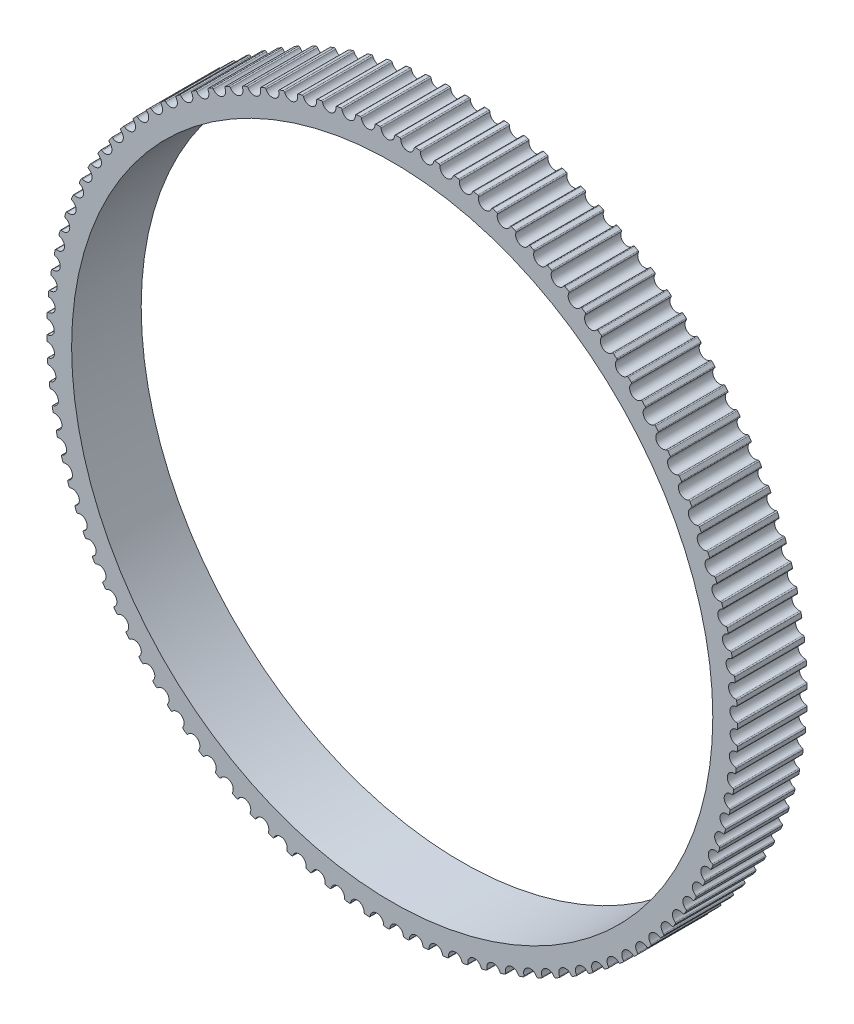
from build123d import *

# Parameters (mm, degrees)
BOSS_EXTRUDE1_DEPTH = 3.5
SKETCH4_R           = 32.25
CUT_EXTRUDE2_DEPTH  = 3.5


with BuildPart() as part:
    # Sketch2 → Boss-Extrude1 (new, symmetric)
    with BuildSketch(Plane.XY):
        with BuildLine():
            ThreePointArc((-3.211333328, 34.601298216), (-3.132582306, 34.577768977), (-3.092122191, 34.506226488))
            ThreePointArc((-3.092122191, 34.506226488), (-2.370608918, 33.917255392), (-1.738041502, 34.600868455))
            ThreePointArc((-1.738041502, 34.600868455), (-1.707926922, 34.677343683), (-1.633214692, 34.711599067))
            ThreePointArc((-1.633214692, 34.711599067), (-1.432005901, 34.720481839), (-1.230749008, 34.728198296))
            ThreePointArc((-1.230749008, 34.728198296), (-1.153469677, 34.700211628), (-1.117159824, 34.626475997))
            ThreePointArc((-1.117159824, 34.626475997), (-0.430446923, 33.997275118), (0.240115498, 34.643660757))
            ThreePointArc((0.240115498, 34.643660757), (0.274546844, 34.718292057), (0.351092826, 34.748226341))
            ThreePointArc((0.351092826, 34.748226341), (0.552480572, 34.745607855), (0.75384976, 34.741822211))
            ThreePointArc((0.75384976, 34.741822211), (0.829405331, 34.709469401), (0.861446487, 34.63378114))
            ThreePointArc((0.861446487, 34.63378114), (1.5111191, 33.966402798), (2.217489291, 34.573452638))
            ThreePointArc((2.217489291, 34.573452638), (2.256125096, 34.645996578), (2.334255151, 34.671512123))
            ThreePointArc((2.334255151, 34.671512123), (2.535164969, 34.657400921), (2.735989626, 34.642125523))
            ThreePointArc((2.735989626, 34.642125523), (2.809574991, 34.6055121), (2.837242938, 34.528118086))
            ThreePointArc((2.837242938, 34.528118086), (3.447756167, 33.824739133), (4.187630095, 34.390473103))
            ThreePointArc((4.187630095, 34.390473103), (4.230344336, 34.460693059), (4.309803622, 34.481706639))
            ThreePointArc((4.309803622, 34.481706639), (4.509580184, 34.456148748), (4.709205264, 34.429433422))
            ThreePointArc((4.709205264, 34.429433422), (4.780580401, 34.388678811), (4.803784892, 34.309831489))
            ThreePointArc((4.803784892, 34.309831489), (5.373147369, 33.572746199), (6.14411172, 34.095318993))
            ThreePointArc((6.14411172, 34.095318993), (6.190765072, 34.162985922), (6.271294408, 34.179428995))
            ThreePointArc((6.271294408, 34.179428995), (6.469286087, 34.14250778), (6.667060452, 34.104439666))
            ThreePointArc((6.667060452, 34.104439666), (6.735992552, 34.059676799), (6.754657899, 33.979633352))
            ThreePointArc((6.754657899, 33.979633352), (7.281012482, 33.211245945), (8.080552529, 33.68895304))
            ThreePointArc((8.080552529, 33.68895304), (8.13099282, 33.753846226), (8.212329536, 33.765665158))
            ThreePointArc((8.212329536, 33.765665158), (8.407890523, 33.717501049), (8.603169075, 33.668204316))
            ThreePointArc((8.603169075, 33.668204316), (8.669433295, 33.619579201), (8.683498616, 33.538600714))
            ThreePointArc((8.683498616, 33.538600714), (9.165128446, 32.74141751), (9.990636256, 33.172700723))
            ThreePointArc((9.990636256, 33.172700723), (10.044698959, 33.2346085), (10.126577752, 33.24176474))
            ThreePointArc((10.126577752, 33.24176474), (10.319070167, 33.182514837), (10.511215949, 33.122150282))
            ThreePointArc((10.511215949, 33.122150282), (10.574596148, 33.069821524), (10.584015565, 32.988172132))
            ThreePointArc((10.584015565, 32.988172132), (11.019349666, 32.164793376), (11.868132604, 32.548245952))
            ThreePointArc((11.868132604, 32.548245952), (11.925641377, 32.606966388), (12.007795176, 32.609436594))
            ThreePointArc((12.007795176, 32.609436594), (12.196591149, 32.539294158), (12.384977421, 32.468058678))
            ThreePointArc((12.384977421, 32.468058678), (12.445266867, 32.412196962), (12.450009655, 32.330142989))
            ThreePointArc((12.450009655, 32.330142989), (12.837628057, 31.483254372), (13.70691757, 31.817625568))
            ThreePointArc((13.70691757, 31.817625568), (13.767684832, 31.87296713), (13.849845668, 31.870743245))
            ThreePointArc((13.849845668, 31.870743245), (14.034329387, 31.789937066), (14.21834167, 31.708063015))
            ThreePointArc((14.21834167, 31.708063015), (14.275343712, 31.648850551), (14.275394401, 31.566659639))
            ThreePointArc((14.275394401, 31.566659639), (14.614032774, 30.699023536), (15.50099342, 30.983222703))
            ThreePointArc((15.50099342, 30.983222703), (15.564820961, 31.035004878), (15.646720842, 31.028094155))
            ThreePointArc((15.646720842, 31.028094155), (15.826290558, 30.936887807), (16.005328645, 30.844642241))
            ThreePointArc((16.005328645, 30.844642241), (16.058857353, 30.782272168), (16.054215778, 30.700212407))
            ThreePointArc((16.054215778, 30.700212407), (16.342769554, 29.814658866), (17.244508252, 30.047759005))
            ThreePointArc((17.244508252, 30.047759005), (17.31118788, 30.09581289), (17.392559666, 30.084237871))
            ThreePointArc((17.392559666, 30.084237871), (17.56662966, 29.982928849), (17.740109564, 29.880612655))
            ThreePointArc((17.740109564, 29.880612655), (17.78999034, 29.815288411), (17.78067164, 29.733627463))
            ThreePointArc((17.78067164, 29.733627463), (18.018199616, 28.833044976), (18.931775082, 29.014285763))
            ThreePointArc((18.931775082, 29.014285763), (19.001089301, 29.058454616), (19.081667574, 29.042253056))
            ThreePointArc((19.081667574, 29.042253056), (19.249670067, 28.93117181), (19.417025934, 28.819118722))
            ThreePointArc((19.417025934, 28.819118722), (19.463096075, 28.75105338), (19.449130647, 28.670057606))
            ThreePointArc((19.449130647, 28.670057606), (19.634858056, 27.757383686), (20.557290396, 27.886173951))
            ThreePointArc((20.557290396, 27.886173951), (20.629013119, 27.926313703), (20.708535049, 27.905538449))
            ThreePointArc((20.708535049, 27.905538449), (20.869922051, 27.785047302), (21.030608, 27.663622813))
            ThreePointArc((21.030608, 27.663622813), (21.072717237, 27.59303839), (21.054150632, 27.512971981))
            ThreePointArc((21.054150632, 27.512971981), (21.187471671, 26.59118358), (22.115752103, 26.667103236))
            ThreePointArc((22.115752103, 26.667103236), (22.189649383, 26.70308296), (22.267855587, 26.677801775))
            ThreePointArc((22.267855587, 26.677801775), (22.422100687, 26.548293745), (22.575592595, 26.417893917))
            ThreePointArc((22.575592595, 26.417893917), (22.613603575, 26.345020643), (22.590496355, 26.26614476))
            ThreePointArc((22.590496355, 26.26614476), (22.670976156, 25.338248561), (23.602076822, 25.361049973))
            ThreePointArc((23.602076822, 25.361049973), (23.677907624, 25.39275231), (23.754543009, 25.363047657))
            ThreePointArc((23.754543009, 25.363047657), (23.901143092, 25.224945172), (24.046940299, 25.085995341))
            ThreePointArc((24.046940299, 25.085995341), (24.080729038, 25.011070915), (24.053156573, 24.933642834))
            ThreePointArc((24.053156573, 24.933642834), (24.08053263, 24.002665441), (25.011416473, 23.972274237))
            ThreePointArc((25.011416473, 23.972274237), (25.088933451, 23.99959578), (25.163748048, 23.965564549))
            ThreePointArc((25.163748048, 23.965564549), (25.302224935, 23.81931807), (25.439851882, 23.672271464))
            ThreePointArc((25.439851882, 23.672271464), (25.469308169, 23.595540272), (25.437360394, 23.519812547))
            ThreePointArc((25.437360394, 23.519812547), (25.411543411, 22.588790615), (26.339174082, 22.505305925))
            ThreePointArc((26.339174082, 22.505305925), (26.418124392, 22.528157557), (26.490874172, 22.489910751))
            ThreePointArc((26.490874172, 22.489910751), (26.62077618, 22.335997304), (26.749783955, 22.181333557))
            ThreePointArc((26.749783955, 22.181333557), (26.77481171, 22.103045881), (26.738592833, 22.029265521))
            ThreePointArc((26.738592833, 22.029265521), (26.65966702, 21.10123585), (27.58101878, 20.964929982))
            ThreePointArc((27.58101878, 20.964929982), (27.661144903, 20.983237166), (27.731592571, 20.940899539))
            ThreePointArc((27.731592571, 20.940899539), (27.852495986, 20.779821157), (27.972463794, 20.61804475))
            ThreePointArc((27.972463794, 20.61804475), (27.99298138, 20.538455949), (27.95260954, 20.466863609))
            ThreePointArc((27.95260954, 20.466863609), (27.820832336, 19.544853239), (28.732899927, 19.356170796))
            ThreePointArc((28.732899927, 19.356170796), (28.813940508, 19.369873818), (28.881856278, 19.323583465))
            ThreePointArc((28.881856278, 19.323583465), (28.99336674, 19.155865553), (29.103903269, 18.987504167))
            ThreePointArc((29.103903269, 18.987504167), (29.119843764, 18.906873842), (29.075450644, 18.837703042))
            ThreePointArc((29.075450644, 18.837703042), (28.89125188, 17.924719379), (29.791060327, 17.684275803))
            ThreePointArc((29.791060327, 17.684275803), (29.872751028, 17.693329967), (29.937913374, 17.643237878))
            ThreePointArc((29.937913374, 17.643237878), (30.039667157, 17.469427497), (30.140411862, 17.295030292))
            ThreePointArc((30.140411862, 17.295030292), (30.15172327, 17.213621443), (30.103453672, 17.147097804))
            ThreePointArc((30.103453672, 17.147097804), (29.867434165, 16.24611881), (30.75204848, 15.954698379))
            ThreePointArc((30.75204848, 15.954698379), (30.834122844, 15.959074151), (30.896319219, 15.905343716))
            ThreePointArc((30.896319219, 15.905343716), (30.987984424, 15.7260078), (31.078608696, 15.546143623))
            ThreePointArc((31.078608696, 15.546143623), (31.085254121, 15.464221788), (31.033265491, 15.400562296))
            ThreePointArc((31.033265491, 15.400562296), (30.746195088, 14.514526779), (31.612729843, 14.173080045))
            ThreePointArc((31.612729843, 14.173080045), (31.69492016, 14.172763152), (31.753947692, 14.115569629))
            ThreePointArc((31.753947692, 14.115569629), (31.835225327, 13.931293134), (31.915433568, 13.746548664))
            ThreePointArc((31.915433568, 13.746548664), (31.917391335, 13.664381057), (31.861853248, 13.603793356))
            ThreePointArc((31.861853248, 13.603793356), (31.524668313, 12.735591378), (32.370297052, 12.345232069))
            ThreePointArc((32.370297052, 12.345232069), (32.452335234, 12.340223546), (32.508001388, 12.279753488))
            ThreePointArc((32.508001388, 12.279753488), (32.578626342, 12.091137485), (32.648156929, 11.902115321))
            ThreePointArc((32.648156929, 11.902115321), (32.645420653, 11.819969954), (32.586514263, 11.762651669))
            ThreePointArc((32.586514263, 11.762651669), (32.200314623, 10.915115125), (33.02227908, 10.477116513))
            ThreePointArc((33.02227908, 10.477116513), (33.103897536, 10.467432696), (33.156020741, 10.403883344))
            ThreePointArc((33.156020741, 10.403883344), (33.215762649, 10.211543059), (33.274388789, 10.018859752))
            ThreePointArc((33.274388789, 10.018859752), (33.266967394, 9.937004566), (33.204884841, 9.883142657))
            ThreePointArc((33.204884841, 9.883142657), (32.770930199, 9.059036036), (33.566549298, 8.57482678))
            ThreePointArc((33.566549298, 8.57482678), (33.647481805, 8.560499256), (33.695892045, 8.494077894))
            ThreePointArc((33.695892045, 8.494077894), (33.744556042, 8.298640702), (33.792086508, 8.102924745))
            ThreePointArc((33.792086508, 8.102924745), (33.780004201, 8.021626735), (33.714947986, 7.971396888))
            ThreePointArc((33.714947986, 7.971396888), (33.234653812, 7.173408254), (34.001332409, 6.644567744))
            ThreePointArc((34.001332409, 6.644567744), (34.081314982, 6.625643246), (34.125854354, 6.556566528))
            ThreePointArc((34.125854354, 6.556566528), (34.163281708, 6.358669904), (34.199561465, 6.160559682))
            ThreePointArc((34.199561465, 6.160559682), (34.182857657, 6.080084025), (34.115039979, 6.033650079))
            ThreePointArc((34.115039979, 6.033650079), (33.589972893, 5.264382305), (34.32521024, 4.69263551))
            ThreePointArc((34.32521024, 4.69263551), (34.403981993, 4.669175766), (34.444505218, 4.597669005))
            ThreePointArc((34.444505218, 4.597669005), (34.470573849, 4.397958446), (34.495484561, 4.198100153))
            ThreePointArc((34.495484561, 4.198100153), (34.474213735, 4.118709344), (34.403855803, 4.076222758))
            ThreePointArc((34.403855803, 4.076222758), (33.835728464, 3.338185035), (34.537126371, 2.725396874))
            ThreePointArc((34.537126371, 2.725396874), (34.614430366, 2.697478404), (34.650805266, 2.623774841))
            ThreePointArc((34.650805266, 2.623774841), (34.665430144, 2.422901762), (34.678890556, 2.221947294))
            ThreePointArc((34.678890556, 2.221947294), (34.653122094, 2.143900289), (34.5804534, 2.105499646))
            ThreePointArc((34.5804534, 2.105499646), (33.971118921, 1.401099299), (34.636389574, 0.74926856))
            ThreePointArc((34.636389574, 0.74926856), (34.711973662, 0.716982429), (34.744081589, 0.641322469))
            ThreePointArc((34.744081589, 0.641322469), (34.74721501, 0.439942076), (34.749181219, 0.238546905))
            ThreePointArc((34.749181219, 0.238546905), (34.718999171, 0.162098278), (34.644256745, 0.127908831))
            ThreePointArc((34.644256745, 0.127908831), (33.99570265, -0.540556531), (34.622676073, -1.229303713))
            ThreePointArc((34.622676073, -1.229303713), (34.696293715, -1.265852194), (34.72402994, -1.343221764))
            ThreePointArc((34.72402994, -1.343221764), (34.715661684, -1.544452609), (34.706127275, -1.745631574))
            ThreePointArc((34.706127275, -1.745631574), (34.67163009, -1.820232465), (34.595057726, -1.850099196))
            ThreePointArc((34.595057726, -1.850099196), (33.909399462, -2.480449178), (34.496030599, -3.203866252))
            ThreePointArc((34.496030599, -3.203866252), (34.567441669, -3.24455787), (34.590715723, -3.323384687))
            ThreePointArc((34.590715723, -3.323384687), (34.570873084, -3.523809611), (34.549869157, -3.724116166))
            ThreePointArc((34.549869157, -3.724116166), (34.511169358, -3.796625987), (34.433016819, -3.822072584))
            ThreePointArc((34.433016819, -3.822072584), (33.712490862, -4.412251116), (34.256866244, -5.167978446))
            ThreePointArc((34.256866244, -5.167978446), (34.325837814, -5.212680473), (34.344573781, -5.292707419))
            ThreePointArc((34.344573781, -5.292707419), (34.313321483, -5.491672679), (34.280916548, -5.690453466))
            ThreePointArc((34.280916548, -5.690453466), (34.238140364, -5.760635705), (34.158662568, -5.781579165))
            ThreePointArc((34.158662568, -5.781579165), (33.405619123, -6.329661207), (33.905963111, -7.115233768))
            ThreePointArc((33.905963111, -7.115233768), (33.97227021, -7.163800395), (33.986406977, -7.24476644))
            ThreePointArc((33.986406977, -7.24476644), (33.943846959, -7.441623052), (33.900146714, -7.638229688))
            ThreePointArc((33.900146714, -7.638229688), (33.853433673, -7.705855426), (33.77288986, -7.722227437))
            ThreePointArc((33.77288986, -7.722227437), (32.989785199, -8.226425259), (33.444465774, -9.039280676))
            ThreePointArc((33.444465774, -9.039280676), (33.507892122, -9.09155349), (33.517383579, -9.173194539))
            ThreePointArc((33.517383579, -9.173194539), (33.463654661, -9.367300397), (33.408801648, -9.561091593))
            ThreePointArc((33.408801648, -9.561091593), (33.358304118, -9.625940249), (33.276957005, -9.637687408))
            ThreePointArc((33.276957005, -9.637687408), (32.466345452, -10.096356422), (32.873879542, -10.93384333))
            ThreePointArc((32.873879542, -10.93384333), (32.934218255, -10.989651827), (32.939033441, -11.071701583))
            ThreePointArc((32.939033441, -11.071701583), (32.874310877, -11.262423555), (32.808484015, -11.452767205))
            ThreePointArc((32.808484015, -11.452767205), (32.754366709, -11.514627255), (32.672481633, -11.521711246))
            ThreePointArc((32.672481633, -11.521711246), (31.837007234, -11.933355369), (32.196065547, -12.792742059))
            ThreePointArc((32.196065547, -12.792742059), (32.253119813, -12.851904204), (32.253243023, -12.934095039))
            ThreePointArc((32.253243023, -12.934095039), (32.177737925, -13.120811029), (32.101151926, -13.307086271))
            ThreePointArc((32.101151926, -13.307086271), (32.043591363, -13.365755941), (31.961435416, -13.368153657))
            ThreePointArc((31.961435416, -13.368153657), (31.103823316, -13.731430191), (31.413234678, -14.609913523))
            ThreePointArc((31.413234678, -14.609913523), (31.466818398, -14.67223634), (31.462249231, -14.754300165))
            ThreePointArc((31.462249231, -14.754300165), (31.376207879, -14.936401144), (31.289112552, -15.118000387))
            ThreePointArc((31.289112552, -15.118000387), (31.228296483, -15.173288309), (31.146137641, -15.170991929))
            ThreePointArc((31.146137641, -15.170991929), (30.269185192, -15.484715942), (30.527940367, -16.379430485))
            ThreePointArc((30.527940367, -16.379430485), (30.577878762, -16.444710691), (30.56863212, -16.52637983))
            ThreePointArc((30.56863212, -16.52637983), (30.472335165, -16.703271823), (30.375014597, -16.879602728))
            ThreePointArc((30.375014597, -16.879602728), (30.31114139, -16.931328564), (30.229247639, -16.924345579))
            ThreePointArc((30.229247639, -16.924345579), (29.335815277, -17.187493768), (29.54307026, -18.09552115))
            ThreePointArc((29.54307026, -18.09552115), (29.589200441, -18.163545815), (29.575306486, -18.24455388))
            ThreePointArc((29.575306486, -18.24455388), (29.469068027, -18.415659902), (29.361839657, -18.586147313))
            ThreePointArc((29.361839657, -18.586147313), (29.295117655, -18.634142344), (29.213756114, -18.622495531))
            ThreePointArc((29.213756114, -18.622495531), (28.30675803, -18.834209562), (28.461836798, -19.752587986))
            ThreePointArc((28.461836798, -19.752587986), (28.504008299, -19.823135227), (28.485512349, -19.903217987))
            ThreePointArc((28.485512349, -19.903217987), (28.369678915, -20.067979925), (28.252892499, -20.232067749))
            ThreePointArc((28.252892499, -20.232067749), (28.183539334, -20.276175426), (28.102975388, -20.259902774))
            ThreePointArc((28.102975388, -20.259902774), (27.185370022, -20.419492079), (27.287766741, -21.345225986))
            ThreePointArc((27.287766741, -21.345225986), (27.325842006, -21.418065692), (27.302804391, -21.496961933))
            ThreePointArc((27.302804391, -21.496961933), (27.177753806, -21.654842369), (27.051790279, -21.811995386))
            ThreePointArc((27.051790279, -21.811995386), (26.980032167, -21.852071837), (26.900528599, -21.831226424))
            ThreePointArc((26.900528599, -21.831226424), (25.975308988, -21.938170457), (26.02468966, -22.868240295))
            ThreePointArc((26.02468966, -22.868240295), (26.058544496, -22.943134878), (26.031040361, -23.020587258))
            ThreePointArc((26.031040361, -23.020587258), (25.897180514, -23.171071219), (25.762450741, -23.320776827))
            ThreePointArc((25.762450741, -23.320776827), (25.688521742, -23.356691333), (25.610337876, -23.331341152))
            ThreePointArc((25.610337876, -23.331341152), (24.680521894, -23.385291083), (24.676725451, -24.316663157))
            ThreePointArc((24.676725451, -24.316663157), (24.706249431, -24.393368328), (24.674368488, -24.469124213))
            ThreePointArc((24.674368488, -24.469124213), (24.532136002, -24.61172085), (24.389079444, -24.753490741))
            ThreePointArc((24.389079444, -24.753490741), (24.313220699, -24.785126155), (24.236611554, -24.755353895))
            ThreePointArc((24.236611554, -24.755353895), (23.305232069, -24.75613375), (23.248270892, -25.685770119))
            ThreePointArc((23.248270892, -25.685770119), (23.273367715, -25.76403568), (23.237213953, -25.83784797))
            ThreePointArc((23.237213953, -25.83784797), (23.087072761, -25.972092163), (22.936156039, -26.105463914))
            ThreePointArc((22.936156039, -26.105463914), (22.858614984, -26.132717049), (22.783830443, -26.098619818))
            ThreePointArc((22.783830443, -26.098619818), (21.85392542, -26.046227054), (21.743985306, -26.971095437))
            ThreePointArc((21.743985306, -26.971095437), (21.764573111, -27.050666103), (21.724264456, -27.122294037))
            ThreePointArc((21.724264456, -27.122294037), (21.566704287, -27.24774791), (21.40841966, -27.372286489))
            ThreePointArc((21.40841966, -27.372286489), (21.329449217, -27.39506845), (21.256733213, -27.356757468))
            ThreePointArc((21.256733213, -27.356757468), (20.331335809, -27.251362979), (20.16877536, -28.168446648))
            ThreePointArc((20.16877536, -28.168446648), (20.184786993, -28.249062876), (20.140454924, -28.318272819))
            ThreePointArc((20.140454924, -28.318272819), (19.975989707, -28.434527167), (19.810853466, -28.549826356))
            ThreePointArc((19.810853466, -28.549826356), (19.730711221, -28.568062833), (19.660300937, -28.525663062))
            ThreePointArc((19.660300937, -28.525663062), (18.742429606, -28.367610623), (18.527779061, -29.273918241))
            ThreePointArc((18.527779061, -29.273918241), (18.539162295, -29.355317077), (18.490951414, -29.421883281))
            ThreePointArc((18.490951414, -29.421883281), (18.320117601, -29.528558907), (18.148668386, -29.634242622))
            ThreePointArc((18.148668386, -29.634242622), (18.067615746, -29.647874132), (17.999740847, -29.601523872))
            ThreePointArc((17.999740847, -29.601523872), (17.092389494, -29.391329017), (16.826348997, -30.283904397))
            ThreePointArc((16.826348997, -30.283904397), (16.833066704, -30.365820336), (16.781134264, -30.429525675))
            ThreePointArc((16.781134264, -30.429525675), (16.604489078, -30.526274624), (16.427286122, -30.621998149))
            ThreePointArc((16.427286122, -30.621998149), (16.345587463, -30.630980229), (16.280469342, -30.580830663))
            ThreePointArc((16.280469342, -30.580830663), (15.38659756, -30.319179005), (15.07003488, -31.195110751))
            ThreePointArc((15.07003488, -31.195110751), (15.072065148, -31.2772766), (15.016580542, -31.337913281))
            ThreePointArc((15.016580542, -31.337913281), (14.834700164, -31.42441998), (14.652321465, -31.509871083))
            ThreePointArc((14.652321465, -31.509871083), (14.570243272, -31.514174435), (14.508094331, -31.460389142))
            ThreePointArc((14.508094331, -31.460389142), (13.630617742, -31.148134133), (13.264565442, -32.004565139))
            ThreePointArc((13.264565442, -32.004565139), (13.261901648, -32.086712889), (13.203045856, -32.144083128))
            ThreePointArc((13.203045856, -32.144083128), (13.016523541, -32.220065408), (12.829563981, -32.294965367))
            ThreePointArc((12.829563981, -32.294965367), (12.747373976, -32.294575954), (12.688396932, -32.23733037))
            ThreePointArc((12.688396932, -32.23733037), (11.830177683, -31.875490522), (11.415829748, -32.709627287))
            ThreePointArc((11.415829748, -32.709627287), (11.408480581, -32.791488989), (11.346445578, -32.845405657))
            ThreePointArc((11.346445578, -32.845405657), (11.155889724, -32.910615681), (10.964959126, -32.974720186))
            ThreePointArc((10.964959126, -32.974720186), (10.882925395, -32.969639279), (10.827312619, -32.909120127))
            ThreePointArc((10.827312619, -32.909120127), (9.991150043, -32.498875685), (9.529857991, -33.307997429))
            ThreePointArc((9.529857991, -33.307997429), (9.517847422, -33.389306069), (9.452835553, -33.439593299))
            ThreePointArc((9.452835553, -33.439593299), (9.258867713, -33.493818365), (9.064588853, -33.546918322))
            ThreePointArc((9.064588853, -33.546918322), (8.982978974, -33.537162493), (8.930911862, -33.473567174))
            ThreePointArc((8.930911862, -33.473567174), (8.119533349, -33.016256272), (7.612801817, -33.797723808))
            ThreePointArc((7.612801817, -33.797723808), (7.596169023, -33.878214172), (7.528392344, -33.924707939))
            ThreePointArc((7.528392344, -33.924707939), (7.3316452, -33.967771176), (7.134651776, -34.009693384))
            ThreePointArc((7.134651776, -34.009693384), (7.053731942, -33.995294454), (7.005380328, -33.928830403))
            ThreePointArc((7.005380328, -33.928830403), (6.221432424, -33.425944693), (5.670914266, -34.177209036))
            ThreePointArc((5.670914266, -34.177209036), (5.6497135, -34.256618582), (5.579393083, -34.299167232))
            ThreePointArc((5.579393083, -34.299167232), (5.380508385, -34.330928177), (5.181442947, -34.361535894))
            ThreePointArc((5.181442947, -34.361535894), (5.101477103, -34.34254083), (5.056998699, -34.27342484))
            ThreePointArc((5.056998699, -34.27342484), (4.30303848, -33.72660463), (3.710529372, -34.445215311))
            ThreePointArc((3.710529372, -34.445215311), (3.684829785, -34.523285023), (3.612195002, -34.561749771))
            ThreePointArc((3.612195002, -34.561749771), (3.411821469, -34.582104827), (3.211333328, -34.601298216))
            ThreePointArc((3.211333328, -34.601298216), (3.132582306, -34.577768977), (3.092122191, -34.506226488))
            ThreePointArc((3.092122191, -34.506226488), (2.370608918, -33.917255392), (1.738041502, -34.600868455))
            ThreePointArc((1.738041502, -34.600868455), (1.707926922, -34.677343683), (1.633214692, -34.711599067))
            ThreePointArc((1.633214692, -34.711599067), (1.432005901, -34.720481839), (1.230749008, -34.728198296))
            ThreePointArc((1.230749008, -34.728198296), (1.153469677, -34.700211628), (1.117159824, -34.626475997))
            ThreePointArc((1.117159824, -34.626475997), (0.430446923, -33.997275118), (-0.240115498, -34.643660757))
            ThreePointArc((-0.240115498, -34.643660757), (-0.274546844, -34.718292057), (-0.351092826, -34.748226341))
            ThreePointArc((-0.351092826, -34.748226341), (-0.552480572, -34.745607855), (-0.75384976, -34.741822211))
            ThreePointArc((-0.75384976, -34.741822211), (-0.829405331, -34.709469401), (-0.861446487, -34.63378114))
            ThreePointArc((-0.861446487, -34.63378114), (-1.5111191, -33.966402798), (-2.217489291, -34.573452638))
            ThreePointArc((-2.217489291, -34.573452638), (-2.256125096, -34.645996578), (-2.334255151, -34.671512123))
            ThreePointArc((-2.334255151, -34.671512123), (-2.535164969, -34.657400921), (-2.735989626, -34.642125523))
            ThreePointArc((-2.735989626, -34.642125523), (-2.809574991, -34.6055121), (-2.837242938, -34.528118086))
            ThreePointArc((-2.837242938, -34.528118086), (-3.447756167, -33.824739133), (-4.187630095, -34.390473103))
            ThreePointArc((-4.187630095, -34.390473103), (-4.230344336, -34.460693059), (-4.309803622, -34.481706639))
            ThreePointArc((-4.309803622, -34.481706639), (-4.509580184, -34.456148748), (-4.709205264, -34.429433422))
            ThreePointArc((-4.709205264, -34.429433422), (-4.780580401, -34.388678811), (-4.803784892, -34.309831489))
            ThreePointArc((-4.803784892, -34.309831489), (-5.373147369, -33.572746199), (-6.14411172, -34.095318993))
            ThreePointArc((-6.14411172, -34.095318993), (-6.190765072, -34.162985922), (-6.271294408, -34.179428995))
            ThreePointArc((-6.271294408, -34.179428995), (-6.469286087, -34.14250778), (-6.667060452, -34.104439666))
            ThreePointArc((-6.667060452, -34.104439666), (-6.735992552, -34.059676799), (-6.754657899, -33.979633352))
            ThreePointArc((-6.754657899, -33.979633352), (-7.281012482, -33.211245945), (-8.080552529, -33.68895304))
            ThreePointArc((-8.080552529, -33.68895304), (-8.13099282, -33.753846226), (-8.212329536, -33.765665158))
            ThreePointArc((-8.212329536, -33.765665158), (-8.407890523, -33.717501049), (-8.603169075, -33.668204316))
            ThreePointArc((-8.603169075, -33.668204316), (-8.669433295, -33.619579201), (-8.683498616, -33.538600714))
            ThreePointArc((-8.683498616, -33.538600714), (-9.165128446, -32.74141751), (-9.990636256, -33.172700723))
            ThreePointArc((-9.990636256, -33.172700723), (-10.044698959, -33.2346085), (-10.126577752, -33.24176474))
            ThreePointArc((-10.126577752, -33.24176474), (-10.319070167, -33.182514837), (-10.511215949, -33.122150282))
            ThreePointArc((-10.511215949, -33.122150282), (-10.574596148, -33.069821524), (-10.584015565, -32.988172132))
            ThreePointArc((-10.584015565, -32.988172132), (-11.019349666, -32.164793376), (-11.868132604, -32.548245952))
            ThreePointArc((-11.868132604, -32.548245952), (-11.925641377, -32.606966388), (-12.007795176, -32.609436594))
            ThreePointArc((-12.007795176, -32.609436594), (-12.196591149, -32.539294158), (-12.384977421, -32.468058678))
            ThreePointArc((-12.384977421, -32.468058678), (-12.445266867, -32.412196962), (-12.450009655, -32.330142989))
            ThreePointArc((-12.450009655, -32.330142989), (-12.837628057, -31.483254372), (-13.70691757, -31.817625568))
            ThreePointArc((-13.70691757, -31.817625568), (-13.767684832, -31.87296713), (-13.849845668, -31.870743245))
            ThreePointArc((-13.849845668, -31.870743245), (-14.034329387, -31.789937066), (-14.21834167, -31.708063015))
            ThreePointArc((-14.21834167, -31.708063015), (-14.275343712, -31.648850551), (-14.275394401, -31.566659639))
            ThreePointArc((-14.275394401, -31.566659639), (-14.614032774, -30.699023536), (-15.50099342, -30.983222703))
            ThreePointArc((-15.50099342, -30.983222703), (-15.564820961, -31.035004878), (-15.646720842, -31.028094155))
            ThreePointArc((-15.646720842, -31.028094155), (-15.826290558, -30.936887807), (-16.005328645, -30.844642241))
            ThreePointArc((-16.005328645, -30.844642241), (-16.058857353, -30.782272168), (-16.054215778, -30.700212407))
            ThreePointArc((-16.054215778, -30.700212407), (-16.342769554, -29.814658866), (-17.244508252, -30.047759005))
            ThreePointArc((-17.244508252, -30.047759005), (-17.31118788, -30.09581289), (-17.392559666, -30.084237871))
            ThreePointArc((-17.392559666, -30.084237871), (-17.56662966, -29.982928849), (-17.740109564, -29.880612655))
            ThreePointArc((-17.740109564, -29.880612655), (-17.78999034, -29.815288411), (-17.78067164, -29.733627463))
            ThreePointArc((-17.78067164, -29.733627463), (-18.018199616, -28.833044976), (-18.931775082, -29.014285763))
            ThreePointArc((-18.931775082, -29.014285763), (-19.001089301, -29.058454616), (-19.081667574, -29.042253056))
            ThreePointArc((-19.081667574, -29.042253056), (-19.249670067, -28.93117181), (-19.417025934, -28.819118722))
            ThreePointArc((-19.417025934, -28.819118722), (-19.463096075, -28.75105338), (-19.449130647, -28.670057606))
            ThreePointArc((-19.449130647, -28.670057606), (-19.634858056, -27.757383686), (-20.557290396, -27.886173951))
            ThreePointArc((-20.557290396, -27.886173951), (-20.629013119, -27.926313703), (-20.708535049, -27.905538449))
            ThreePointArc((-20.708535049, -27.905538449), (-20.869922051, -27.785047302), (-21.030608, -27.663622813))
            ThreePointArc((-21.030608, -27.663622813), (-21.072717237, -27.59303839), (-21.054150632, -27.512971981))
            ThreePointArc((-21.054150632, -27.512971981), (-21.187471671, -26.59118358), (-22.115752103, -26.667103236))
            ThreePointArc((-22.115752103, -26.667103236), (-22.189649383, -26.70308296), (-22.267855587, -26.677801775))
            ThreePointArc((-22.267855587, -26.677801775), (-22.422100687, -26.548293745), (-22.575592595, -26.417893917))
            ThreePointArc((-22.575592595, -26.417893917), (-22.613603575, -26.345020643), (-22.590496355, -26.26614476))
            ThreePointArc((-22.590496355, -26.26614476), (-22.670976156, -25.338248561), (-23.602076822, -25.361049973))
            ThreePointArc((-23.602076822, -25.361049973), (-23.677907624, -25.39275231), (-23.754543009, -25.363047657))
            ThreePointArc((-23.754543009, -25.363047657), (-23.901143092, -25.224945172), (-24.046940299, -25.085995341))
            ThreePointArc((-24.046940299, -25.085995341), (-24.080729038, -25.011070915), (-24.053156573, -24.933642834))
            ThreePointArc((-24.053156573, -24.933642834), (-24.08053263, -24.002665441), (-25.011416473, -23.972274237))
            ThreePointArc((-25.011416473, -23.972274237), (-25.088933451, -23.99959578), (-25.163748048, -23.965564549))
            ThreePointArc((-25.163748048, -23.965564549), (-25.302224935, -23.81931807), (-25.439851882, -23.672271464))
            ThreePointArc((-25.439851882, -23.672271464), (-25.469308169, -23.595540272), (-25.437360394, -23.519812547))
            ThreePointArc((-25.437360394, -23.519812547), (-25.411543411, -22.588790615), (-26.339174082, -22.505305925))
            ThreePointArc((-26.339174082, -22.505305925), (-26.418124392, -22.528157557), (-26.490874172, -22.489910751))
            ThreePointArc((-26.490874172, -22.489910751), (-26.62077618, -22.335997304), (-26.749783955, -22.181333557))
            ThreePointArc((-26.749783955, -22.181333557), (-26.77481171, -22.103045881), (-26.738592833, -22.029265521))
            ThreePointArc((-26.738592833, -22.029265521), (-26.65966702, -21.10123585), (-27.58101878, -20.964929982))
            ThreePointArc((-27.58101878, -20.964929982), (-27.661144903, -20.983237166), (-27.731592571, -20.940899539))
            ThreePointArc((-27.731592571, -20.940899539), (-27.852495986, -20.779821157), (-27.972463794, -20.61804475))
            ThreePointArc((-27.972463794, -20.61804475), (-27.99298138, -20.538455949), (-27.95260954, -20.466863609))
            ThreePointArc((-27.95260954, -20.466863609), (-27.820832336, -19.544853239), (-28.732899927, -19.356170796))
            ThreePointArc((-28.732899927, -19.356170796), (-28.813940508, -19.369873818), (-28.881856278, -19.323583465))
            ThreePointArc((-28.881856278, -19.323583465), (-28.99336674, -19.155865553), (-29.103903269, -18.987504167))
            ThreePointArc((-29.103903269, -18.987504167), (-29.119843764, -18.906873842), (-29.075450644, -18.837703042))
            ThreePointArc((-29.075450644, -18.837703042), (-28.89125188, -17.924719379), (-29.791060327, -17.684275803))
            ThreePointArc((-29.791060327, -17.684275803), (-29.872751028, -17.693329967), (-29.937913374, -17.643237878))
            ThreePointArc((-29.937913374, -17.643237878), (-30.039667157, -17.469427497), (-30.140411862, -17.295030292))
            ThreePointArc((-30.140411862, -17.295030292), (-30.15172327, -17.213621443), (-30.103453672, -17.147097804))
            ThreePointArc((-30.103453672, -17.147097804), (-29.867434165, -16.24611881), (-30.75204848, -15.954698379))
            ThreePointArc((-30.75204848, -15.954698379), (-30.834122844, -15.959074151), (-30.896319219, -15.905343716))
            ThreePointArc((-30.896319219, -15.905343716), (-30.987984424, -15.7260078), (-31.078608696, -15.546143623))
            ThreePointArc((-31.078608696, -15.546143623), (-31.085254121, -15.464221788), (-31.033265491, -15.400562296))
            ThreePointArc((-31.033265491, -15.400562296), (-30.746195088, -14.514526779), (-31.612729843, -14.173080045))
            ThreePointArc((-31.612729843, -14.173080045), (-31.69492016, -14.172763152), (-31.753947692, -14.115569629))
            ThreePointArc((-31.753947692, -14.115569629), (-31.835225327, -13.931293134), (-31.915433568, -13.746548664))
            ThreePointArc((-31.915433568, -13.746548664), (-31.917391335, -13.664381057), (-31.861853248, -13.603793356))
            ThreePointArc((-31.861853248, -13.603793356), (-31.524668313, -12.735591378), (-32.370297052, -12.345232069))
            ThreePointArc((-32.370297052, -12.345232069), (-32.452335234, -12.340223546), (-32.508001388, -12.279753488))
            ThreePointArc((-32.508001388, -12.279753488), (-32.578626342, -12.091137485), (-32.648156929, -11.902115321))
            ThreePointArc((-32.648156929, -11.902115321), (-32.645420653, -11.819969954), (-32.586514263, -11.762651669))
            ThreePointArc((-32.586514263, -11.762651669), (-32.200314623, -10.915115125), (-33.02227908, -10.477116513))
            ThreePointArc((-33.02227908, -10.477116513), (-33.103897536, -10.467432696), (-33.156020741, -10.403883344))
            ThreePointArc((-33.156020741, -10.403883344), (-33.215762649, -10.211543059), (-33.274388789, -10.018859752))
            ThreePointArc((-33.274388789, -10.018859752), (-33.266967394, -9.937004566), (-33.204884841, -9.883142657))
            ThreePointArc((-33.204884841, -9.883142657), (-32.770930199, -9.059036036), (-33.566549298, -8.57482678))
            ThreePointArc((-33.566549298, -8.57482678), (-33.647481805, -8.560499256), (-33.695892045, -8.494077894))
            ThreePointArc((-33.695892045, -8.494077894), (-33.744556042, -8.298640702), (-33.792086508, -8.102924745))
            ThreePointArc((-33.792086508, -8.102924745), (-33.780004201, -8.021626735), (-33.714947986, -7.971396888))
            ThreePointArc((-33.714947986, -7.971396888), (-33.234653812, -7.173408254), (-34.001332409, -6.644567744))
            ThreePointArc((-34.001332409, -6.644567744), (-34.081314982, -6.625643246), (-34.125854354, -6.556566528))
            ThreePointArc((-34.125854354, -6.556566528), (-34.163281708, -6.358669904), (-34.199561465, -6.160559682))
            ThreePointArc((-34.199561465, -6.160559682), (-34.182857657, -6.080084025), (-34.115039979, -6.033650079))
            ThreePointArc((-34.115039979, -6.033650079), (-33.589972893, -5.264382305), (-34.32521024, -4.69263551))
            ThreePointArc((-34.32521024, -4.69263551), (-34.403981993, -4.669175766), (-34.444505218, -4.597669005))
            ThreePointArc((-34.444505218, -4.597669005), (-34.470573849, -4.397958446), (-34.495484561, -4.198100153))
            ThreePointArc((-34.495484561, -4.198100153), (-34.474213735, -4.118709344), (-34.403855803, -4.076222758))
            ThreePointArc((-34.403855803, -4.076222758), (-33.835728464, -3.338185035), (-34.537126371, -2.725396874))
            ThreePointArc((-34.537126371, -2.725396874), (-34.614430366, -2.697478404), (-34.650805266, -2.623774841))
            ThreePointArc((-34.650805266, -2.623774841), (-34.665430144, -2.422901762), (-34.678890556, -2.221947294))
            ThreePointArc((-34.678890556, -2.221947294), (-34.653122094, -2.143900289), (-34.5804534, -2.105499646))
            ThreePointArc((-34.5804534, -2.105499646), (-33.971118921, -1.401099299), (-34.636389574, -0.74926856))
            ThreePointArc((-34.636389574, -0.74926856), (-34.711973662, -0.716982429), (-34.744081589, -0.641322469))
            ThreePointArc((-34.744081589, -0.641322469), (-34.74721501, -0.439942076), (-34.749181219, -0.238546905))
            ThreePointArc((-34.749181219, -0.238546905), (-34.718999171, -0.162098278), (-34.644256745, -0.127908831))
            ThreePointArc((-34.644256745, -0.127908831), (-33.99570265, 0.540556531), (-34.622676073, 1.229303713))
            ThreePointArc((-34.622676073, 1.229303713), (-34.696293715, 1.265852194), (-34.72402994, 1.343221764))
            ThreePointArc((-34.72402994, 1.343221764), (-34.715661684, 1.544452609), (-34.706127275, 1.745631574))
            ThreePointArc((-34.706127275, 1.745631574), (-34.67163009, 1.820232465), (-34.595057726, 1.850099196))
            ThreePointArc((-34.595057726, 1.850099196), (-33.909399462, 2.480449178), (-34.496030599, 3.203866252))
            ThreePointArc((-34.496030599, 3.203866252), (-34.567441669, 3.24455787), (-34.590715723, 3.323384687))
            ThreePointArc((-34.590715723, 3.323384687), (-34.570873084, 3.523809611), (-34.549869157, 3.724116166))
            ThreePointArc((-34.549869157, 3.724116166), (-34.511169358, 3.796625987), (-34.433016819, 3.822072584))
            ThreePointArc((-34.433016819, 3.822072584), (-33.712490862, 4.412251116), (-34.256866244, 5.167978446))
            ThreePointArc((-34.256866244, 5.167978446), (-34.325837814, 5.212680473), (-34.344573781, 5.292707419))
            ThreePointArc((-34.344573781, 5.292707419), (-34.313321483, 5.491672679), (-34.280916548, 5.690453466))
            ThreePointArc((-34.280916548, 5.690453466), (-34.238140364, 5.760635705), (-34.158662568, 5.781579165))
            ThreePointArc((-34.158662568, 5.781579165), (-33.405619123, 6.329661207), (-33.905963111, 7.115233768))
            ThreePointArc((-33.905963111, 7.115233768), (-33.97227021, 7.163800395), (-33.986406977, 7.24476644))
            ThreePointArc((-33.986406977, 7.24476644), (-33.943846959, 7.441623052), (-33.900146714, 7.638229688))
            ThreePointArc((-33.900146714, 7.638229688), (-33.853433673, 7.705855426), (-33.77288986, 7.722227437))
            ThreePointArc((-33.77288986, 7.722227437), (-32.989785199, 8.226425259), (-33.444465774, 9.039280676))
            ThreePointArc((-33.444465774, 9.039280676), (-33.507892122, 9.09155349), (-33.517383579, 9.173194539))
            ThreePointArc((-33.517383579, 9.173194539), (-33.463654661, 9.367300397), (-33.408801648, 9.561091593))
            ThreePointArc((-33.408801648, 9.561091593), (-33.358304118, 9.625940249), (-33.276957005, 9.637687408))
            ThreePointArc((-33.276957005, 9.637687408), (-32.466345452, 10.096356422), (-32.873879542, 10.93384333))
            ThreePointArc((-32.873879542, 10.93384333), (-32.934218255, 10.989651827), (-32.939033441, 11.071701583))
            ThreePointArc((-32.939033441, 11.071701583), (-32.874310877, 11.262423555), (-32.808484015, 11.452767205))
            ThreePointArc((-32.808484015, 11.452767205), (-32.754366709, 11.514627255), (-32.672481633, 11.521711246))
            ThreePointArc((-32.672481633, 11.521711246), (-31.837007234, 11.933355369), (-32.196065547, 12.792742059))
            ThreePointArc((-32.196065547, 12.792742059), (-32.253119813, 12.851904204), (-32.253243023, 12.934095039))
            ThreePointArc((-32.253243023, 12.934095039), (-32.177737925, 13.120811029), (-32.101151926, 13.307086271))
            ThreePointArc((-32.101151926, 13.307086271), (-32.043591363, 13.365755941), (-31.961435416, 13.368153657))
            ThreePointArc((-31.961435416, 13.368153657), (-31.103823316, 13.731430191), (-31.413234678, 14.609913523))
            ThreePointArc((-31.413234678, 14.609913523), (-31.466818398, 14.67223634), (-31.462249231, 14.754300165))
            ThreePointArc((-31.462249231, 14.754300165), (-31.376207879, 14.936401144), (-31.289112552, 15.118000387))
            ThreePointArc((-31.289112552, 15.118000387), (-31.228296483, 15.173288309), (-31.146137641, 15.170991929))
            ThreePointArc((-31.146137641, 15.170991929), (-30.269185192, 15.484715942), (-30.527940367, 16.379430485))
            ThreePointArc((-30.527940367, 16.379430485), (-30.577878762, 16.444710691), (-30.56863212, 16.52637983))
            ThreePointArc((-30.56863212, 16.52637983), (-30.472335165, 16.703271823), (-30.375014597, 16.879602728))
            ThreePointArc((-30.375014597, 16.879602728), (-30.31114139, 16.931328564), (-30.229247639, 16.924345579))
            ThreePointArc((-30.229247639, 16.924345579), (-29.335815277, 17.187493768), (-29.54307026, 18.09552115))
            ThreePointArc((-29.54307026, 18.09552115), (-29.589200441, 18.163545815), (-29.575306486, 18.24455388))
            ThreePointArc((-29.575306486, 18.24455388), (-29.469068027, 18.415659902), (-29.361839657, 18.586147313))
            ThreePointArc((-29.361839657, 18.586147313), (-29.295117655, 18.634142344), (-29.213756114, 18.622495531))
            ThreePointArc((-29.213756114, 18.622495531), (-28.30675803, 18.834209562), (-28.461836798, 19.752587986))
            ThreePointArc((-28.461836798, 19.752587986), (-28.504008299, 19.823135227), (-28.485512349, 19.903217987))
            ThreePointArc((-28.485512349, 19.903217987), (-28.369678915, 20.067979925), (-28.252892499, 20.232067749))
            ThreePointArc((-28.252892499, 20.232067749), (-28.183539334, 20.276175426), (-28.102975388, 20.259902774))
            ThreePointArc((-28.102975388, 20.259902774), (-27.185370022, 20.419492079), (-27.287766741, 21.345225986))
            ThreePointArc((-27.287766741, 21.345225986), (-27.325842006, 21.418065692), (-27.302804391, 21.496961933))
            ThreePointArc((-27.302804391, 21.496961933), (-27.177753806, 21.654842369), (-27.051790279, 21.811995386))
            ThreePointArc((-27.051790279, 21.811995386), (-26.980032167, 21.852071837), (-26.900528599, 21.831226424))
            ThreePointArc((-26.900528599, 21.831226424), (-25.975308988, 21.938170457), (-26.02468966, 22.868240295))
            ThreePointArc((-26.02468966, 22.868240295), (-26.058544496, 22.943134878), (-26.031040361, 23.020587258))
            ThreePointArc((-26.031040361, 23.020587258), (-25.897180514, 23.171071219), (-25.762450741, 23.320776827))
            ThreePointArc((-25.762450741, 23.320776827), (-25.688521742, 23.356691333), (-25.610337876, 23.331341152))
            ThreePointArc((-25.610337876, 23.331341152), (-24.680521894, 23.385291083), (-24.676725451, 24.316663157))
            ThreePointArc((-24.676725451, 24.316663157), (-24.706249431, 24.393368328), (-24.674368488, 24.469124213))
            ThreePointArc((-24.674368488, 24.469124213), (-24.532136002, 24.61172085), (-24.389079444, 24.753490741))
            ThreePointArc((-24.389079444, 24.753490741), (-24.313220699, 24.785126155), (-24.236611554, 24.755353895))
            ThreePointArc((-24.236611554, 24.755353895), (-23.305232069, 24.75613375), (-23.248270892, 25.685770119))
            ThreePointArc((-23.248270892, 25.685770119), (-23.273367715, 25.76403568), (-23.237213953, 25.83784797))
            ThreePointArc((-23.237213953, 25.83784797), (-23.087072761, 25.972092163), (-22.936156039, 26.105463914))
            ThreePointArc((-22.936156039, 26.105463914), (-22.858614984, 26.132717049), (-22.783830443, 26.098619818))
            ThreePointArc((-22.783830443, 26.098619818), (-21.85392542, 26.046227054), (-21.743985306, 26.971095437))
            ThreePointArc((-21.743985306, 26.971095437), (-21.764573111, 27.050666103), (-21.724264456, 27.122294037))
            ThreePointArc((-21.724264456, 27.122294037), (-21.566704287, 27.24774791), (-21.40841966, 27.372286489))
            ThreePointArc((-21.40841966, 27.372286489), (-21.329449217, 27.39506845), (-21.256733213, 27.356757468))
            ThreePointArc((-21.256733213, 27.356757468), (-20.331335809, 27.251362979), (-20.16877536, 28.168446648))
            ThreePointArc((-20.16877536, 28.168446648), (-20.184786993, 28.249062876), (-20.140454924, 28.318272819))
            ThreePointArc((-20.140454924, 28.318272819), (-19.975989707, 28.434527167), (-19.810853466, 28.549826356))
            ThreePointArc((-19.810853466, 28.549826356), (-19.730711221, 28.568062833), (-19.660300937, 28.525663062))
            ThreePointArc((-19.660300937, 28.525663062), (-18.742429606, 28.367610623), (-18.527779061, 29.273918241))
            ThreePointArc((-18.527779061, 29.273918241), (-18.539162295, 29.355317077), (-18.490951414, 29.421883281))
            ThreePointArc((-18.490951414, 29.421883281), (-18.320117601, 29.528558907), (-18.148668386, 29.634242622))
            ThreePointArc((-18.148668386, 29.634242622), (-18.067615746, 29.647874132), (-17.999740847, 29.601523872))
            ThreePointArc((-17.999740847, 29.601523872), (-17.092389494, 29.391329017), (-16.826348997, 30.283904397))
            ThreePointArc((-16.826348997, 30.283904397), (-16.833066704, 30.365820336), (-16.781134264, 30.429525675))
            ThreePointArc((-16.781134264, 30.429525675), (-16.604489078, 30.526274624), (-16.427286122, 30.621998149))
            ThreePointArc((-16.427286122, 30.621998149), (-16.345587463, 30.630980229), (-16.280469342, 30.580830663))
            ThreePointArc((-16.280469342, 30.580830663), (-15.38659756, 30.319179005), (-15.07003488, 31.195110751))
            ThreePointArc((-15.07003488, 31.195110751), (-15.072065148, 31.2772766), (-15.016580542, 31.337913281))
            ThreePointArc((-15.016580542, 31.337913281), (-14.834700164, 31.42441998), (-14.652321465, 31.509871083))
            ThreePointArc((-14.652321465, 31.509871083), (-14.570243272, 31.514174435), (-14.508094331, 31.460389142))
            ThreePointArc((-14.508094331, 31.460389142), (-13.630617742, 31.148134133), (-13.264565442, 32.004565139))
            ThreePointArc((-13.264565442, 32.004565139), (-13.261901648, 32.086712889), (-13.203045856, 32.144083128))
            ThreePointArc((-13.203045856, 32.144083128), (-13.016523541, 32.220065408), (-12.829563981, 32.294965367))
            ThreePointArc((-12.829563981, 32.294965367), (-12.747373976, 32.294575954), (-12.688396932, 32.23733037))
            ThreePointArc((-12.688396932, 32.23733037), (-11.830177683, 31.875490522), (-11.415829748, 32.709627287))
            ThreePointArc((-11.415829748, 32.709627287), (-11.408480581, 32.791488989), (-11.346445578, 32.845405657))
            ThreePointArc((-11.346445578, 32.845405657), (-11.155889724, 32.910615681), (-10.964959126, 32.974720186))
            ThreePointArc((-10.964959126, 32.974720186), (-10.882925395, 32.969639279), (-10.827312619, 32.909120127))
            ThreePointArc((-10.827312619, 32.909120127), (-9.991150043, 32.498875685), (-9.529857991, 33.307997429))
            ThreePointArc((-9.529857991, 33.307997429), (-9.517847422, 33.389306069), (-9.452835553, 33.439593299))
            ThreePointArc((-9.452835553, 33.439593299), (-9.258867713, 33.493818365), (-9.064588853, 33.546918322))
            ThreePointArc((-9.064588853, 33.546918322), (-8.982978974, 33.537162493), (-8.930911862, 33.473567174))
            ThreePointArc((-8.930911862, 33.473567174), (-8.119533349, 33.016256272), (-7.612801817, 33.797723808))
            ThreePointArc((-7.612801817, 33.797723808), (-7.596169023, 33.878214172), (-7.528392344, 33.924707939))
            ThreePointArc((-7.528392344, 33.924707939), (-7.3316452, 33.967771176), (-7.134651776, 34.009693384))
            ThreePointArc((-7.134651776, 34.009693384), (-7.053731942, 33.995294454), (-7.005380328, 33.928830403))
            ThreePointArc((-7.005380328, 33.928830403), (-6.221432424, 33.425944693), (-5.670914266, 34.177209036))
            ThreePointArc((-5.670914266, 34.177209036), (-5.6497135, 34.256618582), (-5.579393083, 34.299167232))
            ThreePointArc((-5.579393083, 34.299167232), (-5.380508385, 34.330928177), (-5.181442947, 34.361535894))
            ThreePointArc((-5.181442947, 34.361535894), (-5.101477103, 34.34254083), (-5.056998699, 34.27342484))
            ThreePointArc((-5.056998699, 34.27342484), (-4.30303848, 33.72660463), (-3.710529372, 34.445215311))
            ThreePointArc((-3.710529372, 34.445215311), (-3.684829785, 34.523285023), (-3.612195002, 34.561749771))
            ThreePointArc((-3.612195002, 34.561749771), (-3.411821469, 34.582104827), (-3.211333328, 34.601298216))
        make_face()
    extrude(amount=BOSS_EXTRUDE1_DEPTH, both=True)

    # Sketch4 → Cut-Extrude2 (cut, symmetric)
    with BuildSketch(Plane.XY):
        Circle(SKETCH4_R)
    cut_extrude2 = extrude(amount=CUT_EXTRUDE2_DEPTH, both=True, mode=Mode.SUBTRACT)

    # Mirror1: Cut-Extrude2 across plane
    add(cut_extrude2.mirror(Plane.XY), mode=Mode.SUBTRACT)


solid = part.part
